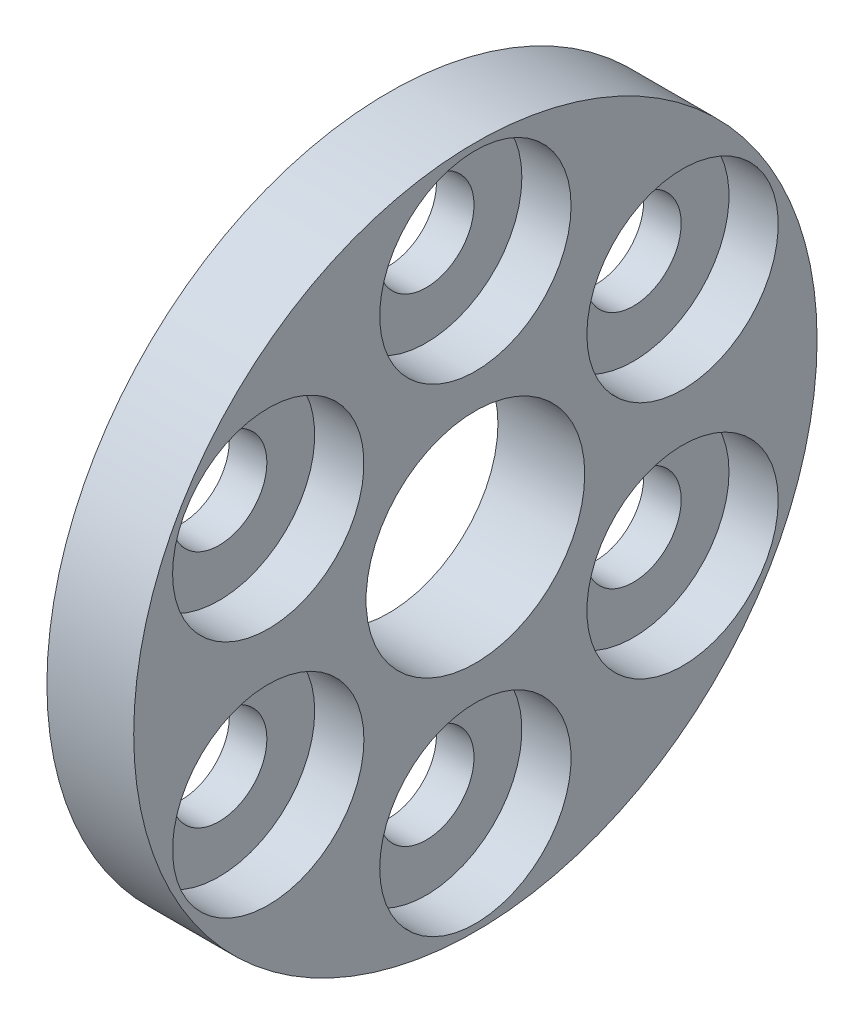
from build123d import *

# Parameters (mm, degrees)
SKETCH1_R           = 12.5
BOSS_EXTRUDE1_DEPTH = 3.175
SKETCH3_R           = 4
CUT_EXTRUDE1_DEPTH  = 18.960529641
SKETCH2_R           = 1.75
CUT_EXTRUDE2_DEPTH  = 18.960529641
SKETCH4_R           = 3.5
CUT_EXTRUDE3_DEPTH  = 1.8
CIRPATTERN1_COUNT   = 6


with BuildPart() as part:
    # Sketch1 → Boss-Extrude1 (new body)
    with BuildSketch(Plane(origin=(0, 0, 0), x_dir=(0, 0, -1), z_dir=(1, 0, 0))):
        Circle(SKETCH1_R)
    extrude(amount=BOSS_EXTRUDE1_DEPTH)

    # Sketch3 → Cut-Extrude1 (cut, through all)
    with BuildSketch(Plane(origin=(3.175, 0, 0), x_dir=(0, 0, -1), z_dir=(1, 0, 0))):
        Circle(SKETCH3_R)
    extrude(amount=-CUT_EXTRUDE1_DEPTH, mode=Mode.SUBTRACT)

    # Sketch2 → Cut-Extrude2 (cut, through all)
    with BuildSketch(Plane(origin=(3.175, 0, 0), x_dir=(0, 0, -1), z_dir=(1, 0, 0))):
        with Locations((0, 8.75)):
            Circle(SKETCH2_R)
    cut_extrude2 = extrude(amount=-CUT_EXTRUDE2_DEPTH, mode=Mode.SUBTRACT)

    # Sketch4 → Cut-Extrude3 (cut)
    with BuildSketch(Plane(origin=(3.175, 0, 0), x_dir=(0, 0, -1), z_dir=(1, 0, 0))):
        with Locations((0, 8.75)):
            Circle(SKETCH4_R)
    cut_extrude3 = extrude(amount=-CUT_EXTRUDE3_DEPTH, mode=Mode.SUBTRACT)

    # CirPattern1: Cut-Extrude2, Cut-Extrude3 ×6 about axis
    cirpattern1_axis = Axis((3.175, 0, 0), (1, 0, 0))
    add([cut_extrude2.rotate(cirpattern1_axis, i * 360 / CIRPATTERN1_COUNT) for i in range(1, CIRPATTERN1_COUNT)], mode=Mode.SUBTRACT)
    add([cut_extrude3.rotate(cirpattern1_axis, i * 360 / CIRPATTERN1_COUNT) for i in range(1, CIRPATTERN1_COUNT)], mode=Mode.SUBTRACT)


solid = part.part
